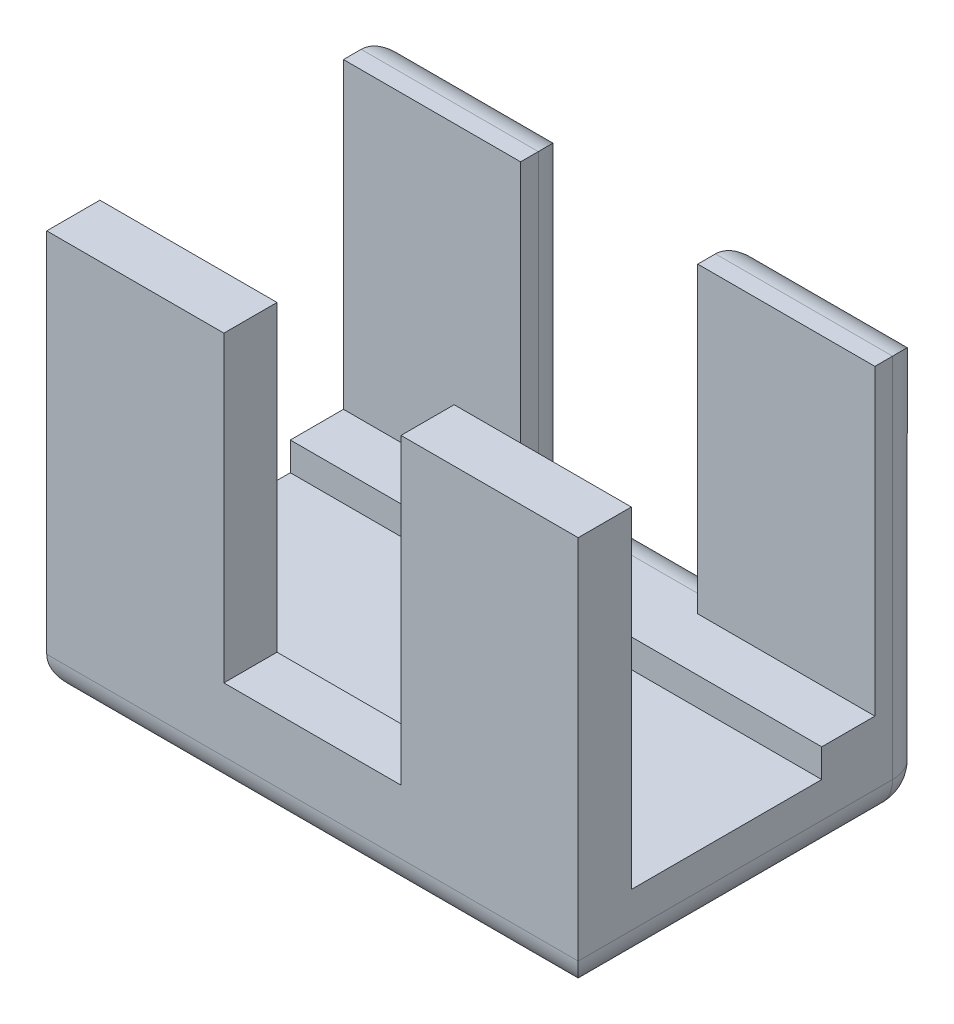
from build123d import *

# Parameters (mm, degrees)
SKETCH1_W           = 30
SKETCH1_H           = 19.75
BOSS_EXTRUDE1_DEPTH = 4
SKETCH2_W           = 30
SKETCH2_H           = 6
BOSS_EXTRUDE2_DEPTH = 1.601
SKETCH3_W           = 10
SKETCH3_H           = 3
BOSS_EXTRUDE3_DEPTH = 18.7
SKETCH4_W           = 10
SKETCH4_H           = 3
BOSS_EXTRUDE4_DEPTH = 17.099
SKETCH5_W           = 10
SKETCH5_H           = 3
BOSS_EXTRUDE5_DEPTH = 1.601
FILLET1_R           = 2


with BuildPart() as part:
    # Sketch1 → Boss-Extrude1 (new body)
    with BuildSketch(Plane(origin=(0, 0, 0), x_dir=(1, 0, 0), z_dir=(0, 1, 0))):
        with Locations((15, 9.875)):
            Rectangle(SKETCH1_W, SKETCH1_H)
    extrude(amount=BOSS_EXTRUDE1_DEPTH)

    # Sketch2 → Boss-Extrude2 (add)
    with BuildSketch(Plane(origin=(0, 4, 0), x_dir=(1, 0, 0), z_dir=(0, 1, 0))):
        with Locations((15, 16.75)):
            Rectangle(SKETCH2_W, SKETCH2_H)
    extrude(amount=BOSS_EXTRUDE2_DEPTH)

    # Sketch3 → Boss-Extrude3 (add)
    with BuildSketch(Plane(origin=(0, 4, 0), x_dir=(1, 0, 0), z_dir=(0, 1, 0))):
        with Locations((5, 1.5)):
            Rectangle(SKETCH3_W, SKETCH3_H)
        with Locations((25, 1.5)):
            Rectangle(SKETCH3_W, SKETCH3_H)
    extrude(amount=BOSS_EXTRUDE3_DEPTH)

    # Sketch4 → Boss-Extrude4 (add)
    with BuildSketch(Plane(origin=(0, 5.601, 0), x_dir=(1, 0, 0), z_dir=(0, 1, 0))):
        with Locations((5, 18.25)):
            Rectangle(SKETCH4_W, SKETCH4_H)
        with Locations((25, 18.25)):
            Rectangle(SKETCH4_W, SKETCH4_H)
    extrude(amount=BOSS_EXTRUDE4_DEPTH)

    # Sketch5 → Boss-Extrude5 (add)
    with BuildSketch(Plane(origin=(0, 4, 0), x_dir=(1, 0, 0), z_dir=(0, 1, 0))):
        with Locations((15, 1.5)):
            Rectangle(SKETCH5_W, SKETCH5_H)
    extrude(amount=BOSS_EXTRUDE5_DEPTH)

    # Fillet1
    fillet1_edges = [part.edges().sort_by_distance(p)[0] for p in [
        (30, 11.35, -19.75),
        (25, 22.7, -19.75),
        (20, 14.1505, -19.75),
        (15, 5.601, -19.75),
        (10, 14.1505, -19.75),
        (5, 22.7, -19.75),
        (0, 11.35, -19.75),
        (15, 0, 0),
        (30, 0, -9.875),
        (15, 0, -19.75),
        (0, 0, -9.875),
    ]]
    fillet(fillet1_edges, radius=FILLET1_R)


solid = part.part
